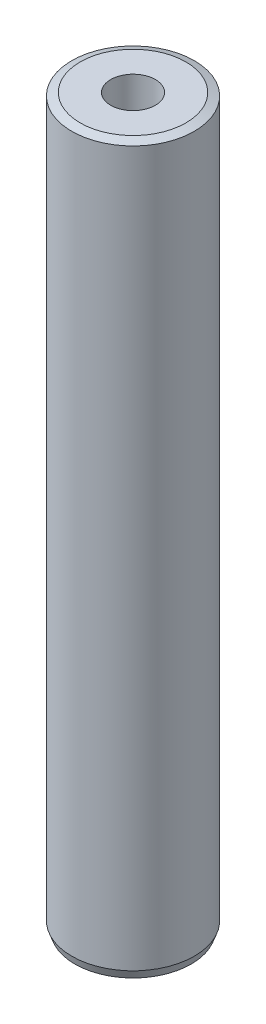
from build123d import *
from OCP.BRepFilletAPI import BRepFilletAPI_MakeChamfer

# Parameters (mm, degrees)
SKETCH1_R           = 40
BOSS_EXTRUDE1_DEPTH = 473.883408046
SKETCH2_R           = 14.588695058
CUT_EXTRUDE1_DEPTH  = 478.247822857
CHAMFER1_SIZE       = 2.015029085
CHAMFER1_SIZE2      = 5.488467682


with BuildPart() as part:
    # Sketch1 → Boss-Extrude1 (new body)
    with BuildSketch(Plane(origin=(0, 0, 0), x_dir=(1, 0, 0), z_dir=(0, 1, 0))):
        Circle(SKETCH1_R)
    extrude(amount=BOSS_EXTRUDE1_DEPTH)

    # Sketch2 → Cut-Extrude1 (cut, through all)
    with BuildSketch(Plane(origin=(0, 0, 0), x_dir=(1, 0, 0), z_dir=(0, 1, 0))):
        Circle(SKETCH2_R)
    extrude(amount=CUT_EXTRUDE1_DEPTH, mode=Mode.SUBTRACT)

    # Chamfer1: one chamfer whose edges measure the first distance from different faces: ONE call of the kernel's chamfer builder (chamfer() names one face for all edges)
    chamfer1_edges_1 = [part.edges().sort_by_distance(p)[0] for p in [
        (-40, 473.883408046, 0),
    ]]
    chamfer1_side_1 = [part.faces().sort_by_distance(p)[0] for p in [
        (-40, 236.941704023, 0),
    ]]
    chamfer1_edges_2 = [part.edges().sort_by_distance(p)[0] for p in [
        (-40, 0, 0),
    ]]
    chamfer1_side_2 = [part.faces().sort_by_distance(p)[0] for p in [
        (-38.86862915, 0, 0),
    ]]
    chamfer1 = BRepFilletAPI_MakeChamfer(part.part.solid().wrapped)
    for e in chamfer1_edges_1:
        chamfer1.Add(CHAMFER1_SIZE, CHAMFER1_SIZE2, e.wrapped, chamfer1_side_1[0].wrapped)  # the first distance lies on this face
    for e in chamfer1_edges_2:
        chamfer1.Add(CHAMFER1_SIZE, CHAMFER1_SIZE2, e.wrapped, chamfer1_side_2[0].wrapped)  # the first distance lies on this face
    add(Compound.cast(chamfer1.Shape()), mode=Mode.REPLACE)


solid = part.part
